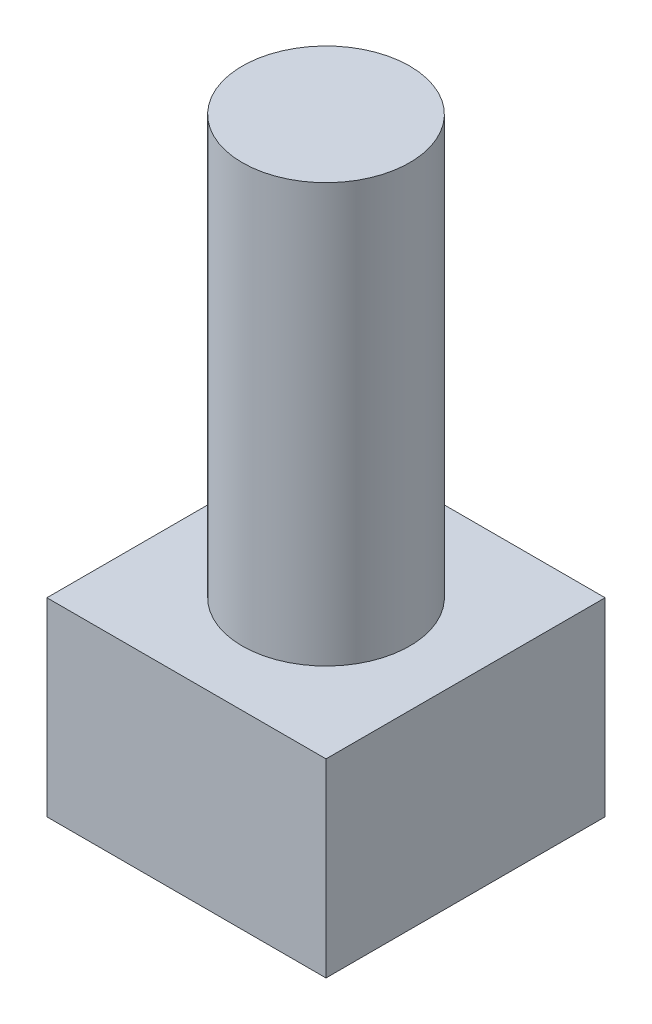
from build123d import *

# Parameters (mm, degrees)
SKETCH1_W           = 10
SKETCH1_H           = 10
BOSS_EXTRUDE1_DEPTH = 6.8
SKETCH2_R           = 3
BOSS_EXTRUDE2_DEPTH = 15


with BuildPart() as part:
    # Sketch1 → Boss-Extrude1 (new body)
    with BuildSketch(Plane(origin=(0, 0, 0), x_dir=(1, 0, 0), z_dir=(0, 1, 0))):
        Rectangle(SKETCH1_W, SKETCH1_H)
    extrude(amount=BOSS_EXTRUDE1_DEPTH)

    # Sketch2 → Boss-Extrude2 (add)
    with BuildSketch(Plane(origin=(0, 6.8, 0), x_dir=(1, 0, 0), z_dir=(0, 1, 0))):
        Circle(SKETCH2_R)
    extrude(amount=BOSS_EXTRUDE2_DEPTH)


solid = part.part
